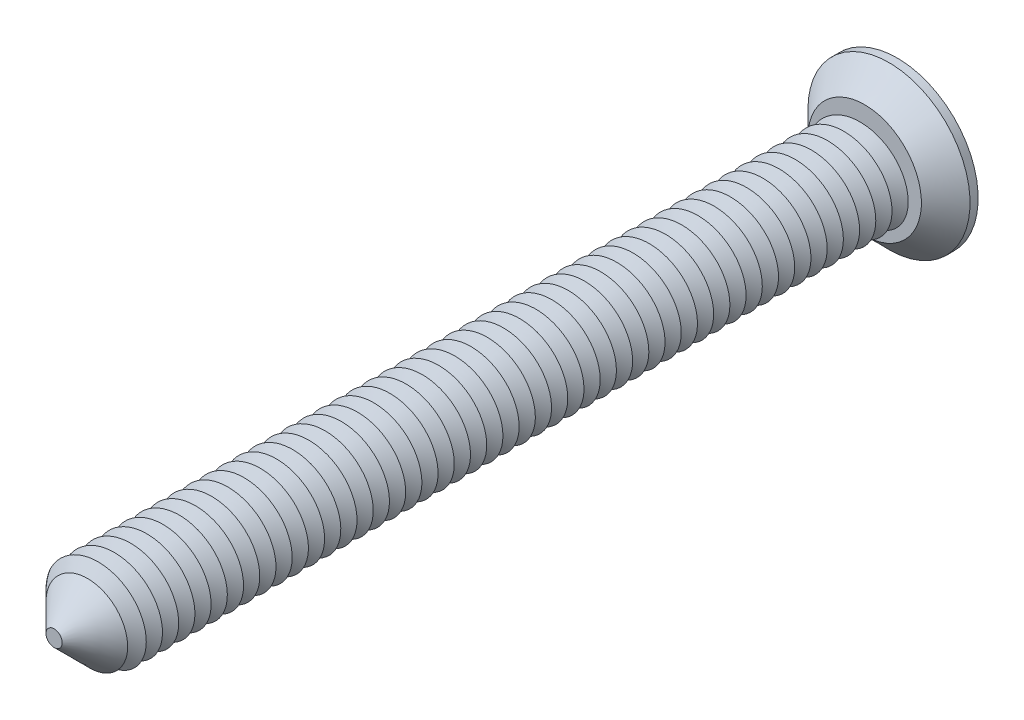
from build123d import *

# Parameters (mm, degrees)
ESBO_O24_R                = 0.3
RESSALTO_EXTRUS_O3_DEPTH  = 5
CHANFRO3_SIZE             = 0.25
VARREDURA_DE_CORTE3_PITCH = 0.1
ESBO_O27_R                = 0.5
RESSALTO_EXTRUS_O4_DEPTH  = 0.2
CHANFRO4_SIZE             = 0.15
CORTE_EXTRUS_O1_DEPTH     = 0.05
FILETE1_R                 = 0.02


with BuildPart() as part:
    # Esboço24 → Ressalto-extrusão3 (new body)
    with BuildSketch(Plane.XY):
        Circle(ESBO_O24_R)
    extrude(amount=RESSALTO_EXTRUS_O3_DEPTH)

    # Chanfro3
    chanfro3_edges = [part.edges().sort_by_distance(p)[0] for p in [
        (-0.3, 0, 5),
    ]]
    chamfer(chanfro3_edges, length=CHANFRO3_SIZE)

    # Varredura de corte3: arcs per turn and ends read off the stored shape
    # Varredura de corte3: the profile of Esboço26 screwed along a right-hand helix through 51 turns, 6 arcs to a turn; built about Z, then put on its axis
    varredura_de_corte3_z = Axis((0, 0, 0), (0, 0, 1))
    varredura_de_corte3_corners = [(0.20098475, 0, 0.005439711), (0.35098475, 0, 0.092042251), (0.35098475, 0, -0.081162829)]
    with BuildLine(mode=Mode.PRIVATE) as varredura_de_corte3_profile:
        Line(varredura_de_corte3_corners[0], varredura_de_corte3_corners[1])
        Line(varredura_de_corte3_corners[1], varredura_de_corte3_corners[2])
        Line(varredura_de_corte3_corners[2], varredura_de_corte3_corners[0])
    varredura_de_corte3_cap = Face(varredura_de_corte3_profile.wire())
    varredura_de_corte3_turn_angles = [0, 30, 60, 90, 120, 150, 180, 210, 240, 270, 300, 330, 360]
    varredura_de_corte3_turn_weights = [1, 0.8660254037844387, 1, 0.8660254037844387, 1, 0.8660254037844387, 1, 0.8660254037844387, 1, 0.8660254037844387, 1, 0.8660254037844387, 1]
    varredura_de_corte3_turn_rails = [Edge.make_bspline([Vector(p[0], p[1], 0).rotate(varredura_de_corte3_z, varredura_de_corte3_turn_angles[k]) / varredura_de_corte3_turn_weights[k] + Vector(0, 0, p[2] + VARREDURA_DE_CORTE3_PITCH * varredura_de_corte3_turn_angles[k] / 360) for k in range(13)], [0, 0, 0, 1, 1, 2, 2, 3, 3, 4, 4, 5, 5, 6, 6, 6], 2, varredura_de_corte3_turn_weights) for p in varredura_de_corte3_corners]
    varredura_de_corte3_turn_sides = [Face.make_surface_from_curves(varredura_de_corte3_turn_rails[p[0]], varredura_de_corte3_turn_rails[p[1]]) for p in [(0, 1), (1, 2), (2, 0)]]
    varredura_de_corte3_turn = Solid(Shell([*varredura_de_corte3_turn_sides, varredura_de_corte3_cap, varredura_de_corte3_cap.rotate(varredura_de_corte3_z, 360).moved(Location((0, 0, VARREDURA_DE_CORTE3_PITCH * 360 / 360)))]))
    varredura_de_corte3_each = [*[varredura_de_corte3_turn.moved(Location((0, 0, VARREDURA_DE_CORTE3_PITCH * i))) for i in range(51)]]
    add(Plane(origin=(0, 0, 5), x_dir=(0, 1, 0), z_dir=(0, 0, -1)) * Compound([varredura_de_corte3_each[i] for i in range(0, 51, 2)]), mode=Mode.SUBTRACT)
    add(Plane(origin=(0, 0, 5), x_dir=(0, 1, 0), z_dir=(0, 0, -1)) * Compound([varredura_de_corte3_each[i] for i in range(1, 51, 2)]), mode=Mode.SUBTRACT)

    # Esboço27 → Ressalto-extrusão4 (add)
    with BuildSketch(Plane(origin=(0, 0, 0), x_dir=(-1, 0, 0), z_dir=(0, 0, -1))):
        Circle(ESBO_O27_R)
    extrude(amount=RESSALTO_EXTRUS_O4_DEPTH)

    # Chanfro4
    chanfro4_edges = [part.edges().sort_by_distance(p)[0] for p in [
        (0.5, 0, 0),
    ]]
    chamfer(chanfro4_edges, length=CHANFRO4_SIZE)

    # Esboço28 → Corte-extrusão1 (cut)
    with BuildSketch(Plane(origin=(0, 0, -0.2), x_dir=(-1, 0, 0), z_dir=(0, 0, -1))):
        with BuildLine():
            Line((-0.025, -0.45), (0.025, -0.45))
            Line((0.025, -0.45), (0.025, -0.175))
            ThreePointArc((0.025, -0.175), (0.068933983, -0.068933983), (0.175, -0.025))
            Line((0.175, -0.025), (0.45, -0.025))
            Line((0.45, -0.025), (0.45, 0.025))
            Line((0.45, 0.025), (0.175, 0.025))
            ThreePointArc((0.175, 0.025), (0.068933983, 0.068933983), (0.025, 0.175))
            Line((0.025, 0.175), (0.025, 0.45))
            Line((0.025, 0.45), (-0.025, 0.45))
            Line((-0.025, 0.45), (-0.025, 0.175))
            ThreePointArc((-0.025, 0.175), (-0.068933983, 0.068933983), (-0.175, 0.025))
            Line((-0.175, 0.025), (-0.45, 0.025))
            Line((-0.45, 0.025), (-0.45, -0.025))
            Line((-0.45, -0.025), (-0.175, -0.025))
            ThreePointArc((-0.175, -0.025), (-0.068933983, -0.068933983), (-0.025, -0.175))
            Line((-0.025, -0.175), (-0.025, -0.45))
        make_face()
    extrude(amount=-CORTE_EXTRUS_O1_DEPTH, mode=Mode.SUBTRACT)

    # Filete1
    filete1_edges = [part.edges().sort_by_distance(p)[0] for p in [
        (-0.025, 0.3125, -0.15),
        (-0.068933983, 0.068933983, -0.15),
        (-0.3125, -0.025, -0.15),
        (-0.068933983, -0.068933983, -0.15),
        (-0.025, -0.3125, -0.15),
        (0, -0.45, -0.15),
        (0.3125, -0.025, -0.15),
        (0.45, 0, -0.15),
        (0.068933983, 0.068933983, -0.15),
        (0.025, 0.3125, -0.15),
        (0, 0.45, -0.15),
        (-0.3125, 0.025, -0.15),
        (-0.45, 0, -0.15),
        (0.025, -0.3125, -0.15),
        (0.068933983, -0.068933983, -0.15),
        (0.3125, 0.025, -0.15),
    ]]
    fillet(filete1_edges, radius=FILETE1_R)


solid = part.part
